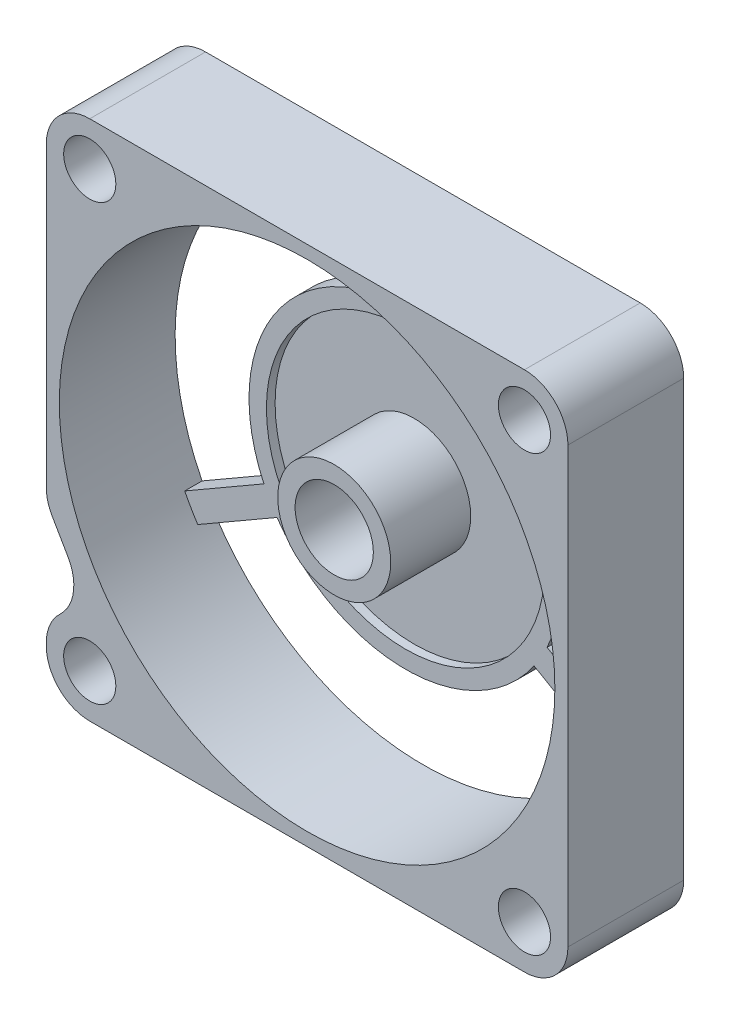
from build123d import *

# Parameters (mm, degrees)
SKETCH1_W           = 30
SKETCH1_H           = 30
SKETCH1_R           = 14.25
SKETCH1_R_2         = 1.5
BOSS_EXTRUDE1_DEPTH = 6.66
BOSS_EXTRUDE2_DEPTH = 1
CIRPATTERN7_COUNT   = 3
SKETCH3_R           = 2.25
CUT_EXTRUDE2_DEPTH  = 23.234108932
SKETCH4_R           = 3.25
SKETCH4_R_2         = 2.25
BOSS_EXTRUDE3_DEPTH = 4.1
FILLET1_R           = 2.5
CUT_EXTRUDE4_START  = -0.5
SKETCH6_R           = 8
SKETCH6_R_2         = 3.25
CUT_EXTRUDE4_DEPTH  = 0.5
CUT_EXTRUDE5_DEPTH  = 5.66
FILLET4_R           = 2.5
FILLET5_R           = 2.5


with BuildPart() as part:
    # Sketch1 → Boss-Extrude1 (new body)
    with BuildSketch(Plane.XY):
        Rectangle(SKETCH1_W, SKETCH1_H)
        Circle(SKETCH1_R, mode=Mode.SUBTRACT)
        with Locations((-12.5, 12.5)):
            Circle(SKETCH1_R_2, mode=Mode.SUBTRACT)
        with Locations((12.5, 12.5)):
            Circle(SKETCH1_R_2, mode=Mode.SUBTRACT)
        with Locations((12.5, -12.5)):
            Circle(SKETCH1_R_2, mode=Mode.SUBTRACT)
        with Locations((-12.5, -12.5)):
            Circle(SKETCH1_R_2, mode=Mode.SUBTRACT)
    extrude(amount=BOSS_EXTRUDE1_DEPTH)

    # Sketch2 → Boss-Extrude2 (add)
    with BuildSketch(Plane.XY):
        with BuildLine():
            Line((-0.75, 8.968695557), (-0.75, 14.230249471))
            ThreePointArc((-0.75, 14.230249471), (-0.375130005, 14.245061512), (0, 14.25))
            Line((0, 14.25), (0, 0))
            Line((0, 0), (-12.340862004, -7.125))
            ThreePointArc((-12.340862004, -7.125), (-12.52415015, -6.797658642), (-12.698757544, -6.465605683))
            Line((-12.698757544, -6.465605683), (-8.142118191, -3.834828726))
            ThreePointArc((-8.142118191, -3.834828726), (-7.794228634, 4.5), (-0.75, 8.968695557))
        make_face()
    boss_extrude2 = extrude(amount=BOSS_EXTRUDE2_DEPTH)

    # CirPattern7: Boss-Extrude2 ×3 about axis
    cirpattern7_axis = Axis((0, 0, 0), (0, 0, 1))
    for i in range(1, CIRPATTERN7_COUNT):
        add(boss_extrude2.rotate(cirpattern7_axis, i * 360 / CIRPATTERN7_COUNT))

    # Sketch3 → Cut-Extrude2 (cut, through all)
    with BuildSketch(Plane.XY):
        with Locations(Location((0, 0, 0), (0, 0, 180))):
            Circle(SKETCH3_R)
    extrude(amount=CUT_EXTRUDE2_DEPTH, mode=Mode.SUBTRACT)

    # Sketch4 → Boss-Extrude3 (add)
    with BuildSketch(Plane.XY.offset(1)):
        with Locations(Location((0, 0, 0), (0, 0, 180))):
            Circle(SKETCH4_R)
        Circle(SKETCH4_R_2, mode=Mode.SUBTRACT)
    extrude(amount=BOSS_EXTRUDE3_DEPTH)

    # Fillet1
    fillet1_edges = [part.edges().sort_by_distance(p)[0] for p in [
        (15, -15, 3.33),
        (-15, -15, 3.33),
        (-15, 15, 3.33),
        (15, 15, 3.33),
    ]]
    fillet(fillet1_edges, radius=FILLET1_R)

    # Sketch6 → Cut-Extrude4 (cut)
    with BuildSketch(Plane.XY.offset(1).offset(CUT_EXTRUDE4_START)):
        Circle(SKETCH6_R)
        Circle(SKETCH6_R_2, mode=Mode.SUBTRACT)
    extrude(amount=CUT_EXTRUDE4_DEPTH, mode=Mode.SUBTRACT)

    # Sketch5 → Cut-Extrude5 (cut)
    with BuildSketch(Plane.XY.offset(6.66)):
        Polygon((-15, -5.283121635), (-12.5, -9.613248654), (-15, -11.056624327), align=None)
    extrude(amount=-CUT_EXTRUDE5_DEPTH, mode=Mode.SUBTRACT)

    # Fillet4
    fillet4_edges = [part.edges().sort_by_distance(p)[0] for p in [
        (-12.5, -9.613248654, 3.83),
    ]]
    fillet(fillet4_edges, radius=FILLET4_R)

    # Fillet5
    # the kernel refuses this fillet: 2.5 mm, written as the material it takes off along each edge
    with BuildSketch(Plane(origin=(-15, -11.056624327, 9.893983241), x_dir=(0, -1, 0), z_dir=(0, 0, -1))) as fillet5_piece_1:
        with BuildLine():
            CenterArc((1.293593296, -2.5), FILLET5_R, 90, 46.920482858)
            Line((-0.532422943, -0.792468245), (-0.715024567, -0.62171507))
            ThreePointArc((-0.715024567, -0.62171507), (-0.409882024, -0.209936491), (-0.216506351, 0.125))
            Line((-0.216506351, 0.125), (0, 0.25))
            Line((0, 0.25), (1.293593296, 0.25))
            Line((1.293593296, 0.25), (1.293593296, 0))
        make_face()
    extrude(amount=8.893983241, mode=Mode.SUBTRACT)
    with BuildSketch(Plane(origin=(-15, -5.283121635, 8.334682453), x_dir=(0.4999999999999945, -0.8660254037844419, 0), z_dir=(0, 0, -1))) as fillet5_piece_2:
        with BuildLine():
            CenterArc((FILLET5_R * 0.267949192431, -FILLET5_R), FILLET5_R, 90, 30)
            Line((-FILLET5_R * 0.232050807569, -FILLET5_R * 0.133974596216), (0, 0))
            Line((0, 0), (FILLET5_R * 0.267949192431, 0))
        make_face()
    extrude(amount=7.334682453, mode=Mode.SUBTRACT)


solid = part.part
